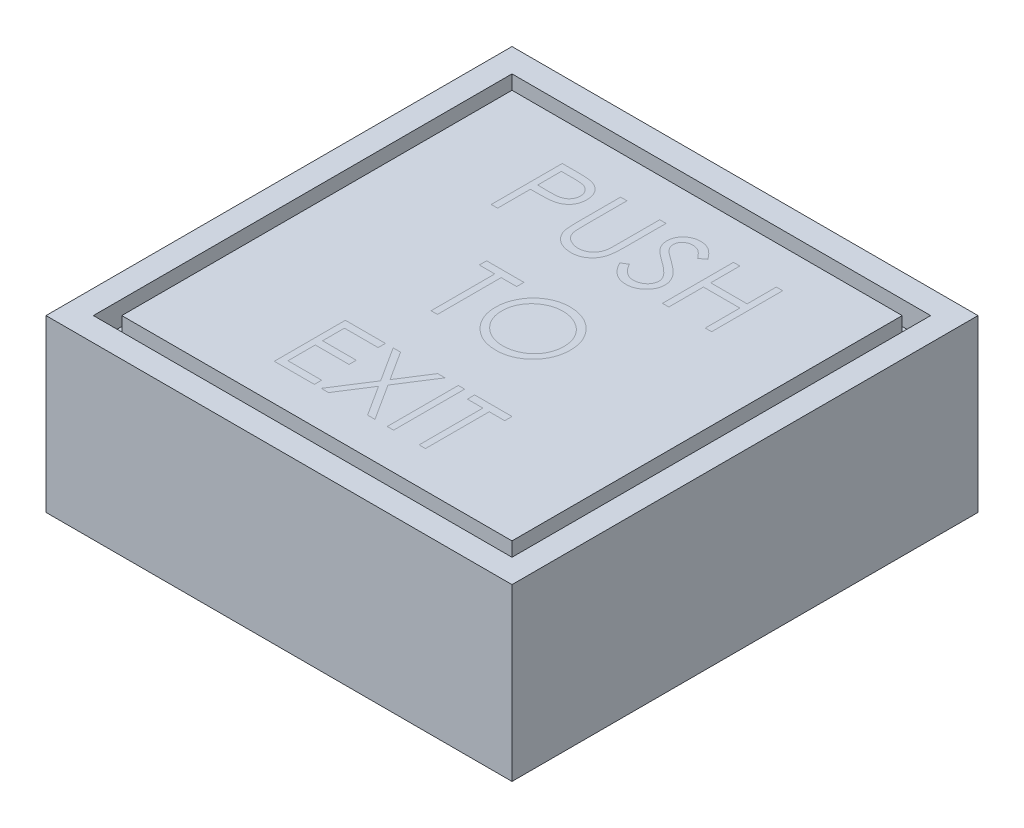
from build123d import *

# Parameters (mm, degrees)
SKETCH1_W           = 124.968
SKETCH1_H           = 124.968
BOSS_EXTRUDE1_DEPTH = 45.72
SKETCH4_W           = 112.268
SKETCH4_H           = 112.268
CUT_EXTRUDE1_DEPTH  = 6.35
SKETCH6_W           = 104.648
SKETCH6_H           = 104.648
BOSS_EXTRUDE2_DEPTH = 6.35


with BuildPart() as part:
    # Sketch1 → Boss-Extrude1 (new body)
    with BuildSketch(Plane(origin=(0, 0, 0), x_dir=(1, 0, 0), z_dir=(0, 1, 0))):
        with Locations((62.484, 62.484)):
            Rectangle(SKETCH1_W, SKETCH1_H)
    extrude(amount=BOSS_EXTRUDE1_DEPTH)

    # Sketch4 → Cut-Extrude1 (cut)
    with BuildSketch(Plane(origin=(0, 45.72, 0), x_dir=(1, 0, 0), z_dir=(0, 1, 0))):
        with Locations((62.484, 62.484)):
            Rectangle(SKETCH4_W, SKETCH4_H)
    extrude(amount=-CUT_EXTRUDE1_DEPTH, mode=Mode.SUBTRACT)

    # Sketch6 → Boss-Extrude2 (add)
    with BuildSketch(Plane(origin=(0, 39.37, 0), x_dir=(1, 0, 0), z_dir=(0, 1, 0))):
        with Locations((62.484, 62.484)):
            Rectangle(SKETCH6_W, SKETCH6_H)
    extrude(amount=BOSS_EXTRUDE2_DEPTH)


solid = part.part
